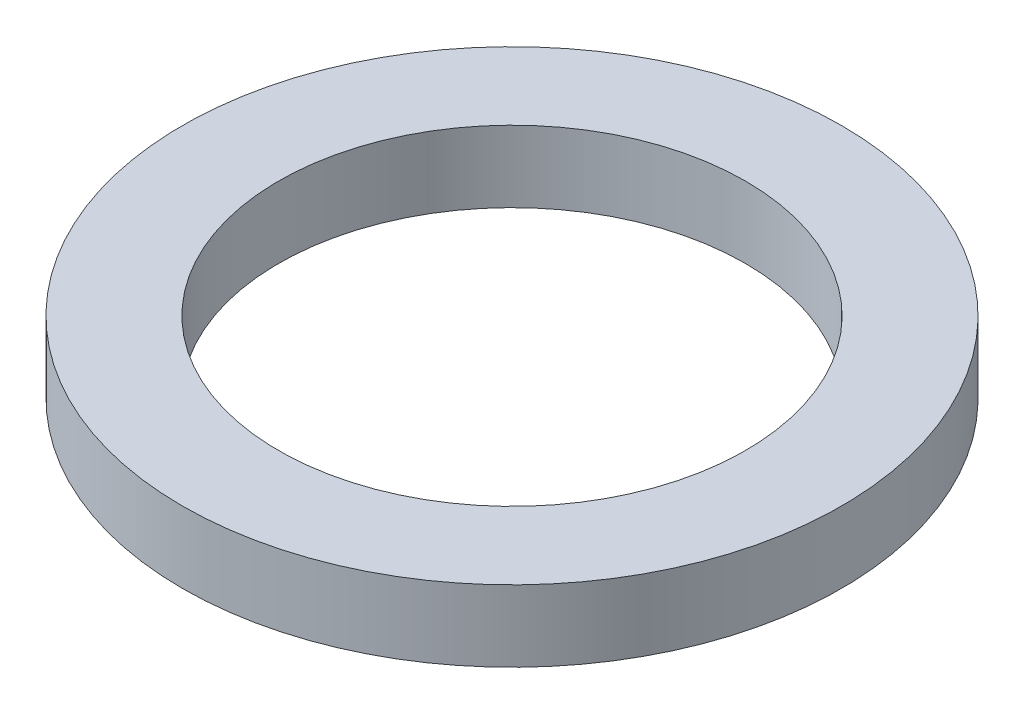
from build123d import *

# Parameters (mm, degrees)
SKETCH1_R           = 60
BOSS_EXTRUDE1_DEPTH = 13
SKETCH2_R           = 42.5
CUT_EXTRUDE1_DEPTH  = 86.842879728


with BuildPart() as part:
    # Sketch1 → Boss-Extrude1 (new body)
    with BuildSketch(Plane(origin=(0, 0, 0), x_dir=(1, 0, 0), z_dir=(0, 1, 0))):
        Circle(SKETCH1_R)
    extrude(amount=BOSS_EXTRUDE1_DEPTH)

    # Sketch2 → Cut-Extrude1 (cut, through all)
    with BuildSketch(Plane(origin=(0, 0, 0), x_dir=(1, 0, 0), z_dir=(0, 1, 0))):
        Circle(SKETCH2_R)
    extrude(amount=CUT_EXTRUDE1_DEPTH, mode=Mode.SUBTRACT)


solid = part.part
